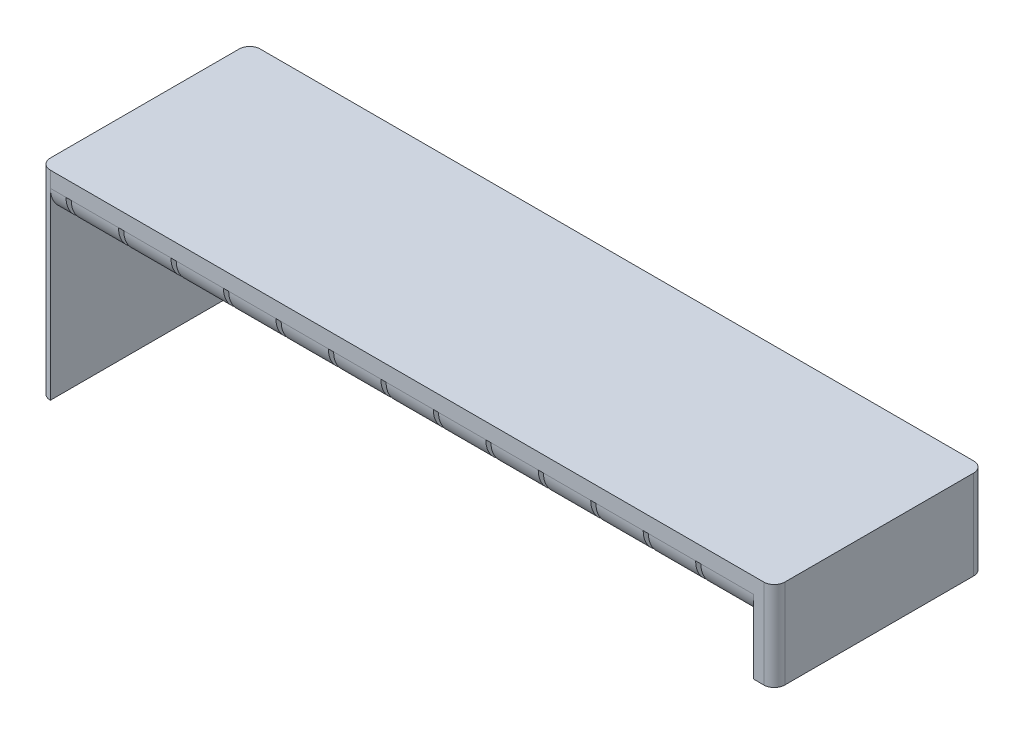
from build123d import *
from build123d.topology import SkipClean

# Parameters (mm, degrees)
SKETCH1_W           = 136
SKETCH1_H           = 40
SKETCH1_W_2         = 2
BOSS_EXTRUDE1_DEPTH = 8
SKETCH1_3_W         = 2
SKETCH1_3_H         = 40
BOSS_EXTRUDE2_DEPTH = 9
SKETCH2_W           = 10.875
SKETCH2_H           = 9
BOSS_EXTRUDE3_DEPTH = 1
BOSS_EXTRUDE4_START = 1
SKETCH2_3_W         = 10.875
SKETCH2_3_H         = 9
SKETCH2_3_W_2       = 17.05
SKETCH2_3_H_2       = 0.6
BOSS_EXTRUDE4_DEPTH = 1
SKETCH1_4_W         = 2
SKETCH1_4_H         = 40
BOSS_EXTRUDE5_DEPTH = 30
SKETCH3_R           = 12.1
CUT_EXTRUDE1_DEPTH  = 132
FILLET1_R           = 5
FILLET2_START       = -31
FILLET2_DEPTH       = 40
BOSS_EXTRUDE6_START = -2
BOSS_EXTRUDE6_DEPTH = 134
FILLET3_R           = 0.5
FILLET5_R           = 1
SKETCH4_W           = 40
SKETCH4_H           = 10
CUT_EXTRUDE2_DEPTH  = 1
LPATTERN1_COUNT     = 13
LPATTERN1_PITCH     = 10


with BuildPart() as part:
    # Sketch1 → Boss-Extrude1 (new body)
    with BuildSketch(Plane(origin=(0, 0, 0), x_dir=(1, 0, 0), z_dir=(0, 1, 0))):
        Rectangle(SKETCH1_W, SKETCH1_H)
        with Locations((69, 0)):
            Rectangle(SKETCH1_W_2, SKETCH1_H)
        with Locations((-69, 0)):
            Rectangle(SKETCH1_W_2, SKETCH1_H)
    extrude(amount=BOSS_EXTRUDE1_DEPTH)

    # Sketch1<3> → Boss-Extrude2 (add)
    with BuildSketch(Plane(origin=(0, 0, 0), x_dir=(1, 0, 0), z_dir=(0, 1, 0))):
        with Locations((69, 0)):
            Rectangle(SKETCH1_3_W, SKETCH1_3_H)
    extrude(amount=-BOSS_EXTRUDE2_DEPTH)

    # Sketch2 → Boss-Extrude3 (add)
    with BuildSketch(Plane.ZY.offset(-68)):
        with Locations((14.5625, -4.5)):
            Rectangle(SKETCH2_W, SKETCH2_H)
        with Locations((-14.5625, -4.5)):
            Rectangle(SKETCH2_W, SKETCH2_H)
    extrude(amount=BOSS_EXTRUDE3_DEPTH)

    # Sketch2<3> → Boss-Extrude4 (add)
    with BuildSketch(Plane.ZY.offset(-68).offset(BOSS_EXTRUDE4_START)):
        Polygon((9.125, -9), (9.125, 0), (8.525, 0), (8.525, -0.6), (8.525, -9), align=None)
        with Locations((14.5625, -4.5)):
            Rectangle(SKETCH2_3_W, SKETCH2_3_H)
        with Locations((0, -0.3)):
            Rectangle(SKETCH2_3_W_2, SKETCH2_3_H_2)
        Polygon((-8.525, -0.6), (-8.525, 0), (-9.125, 0), (-9.125, -9), (-8.525, -9), align=None)
        with Locations((-14.5625, -4.5)):
            Rectangle(SKETCH2_3_W, SKETCH2_3_H)
    extrude(amount=BOSS_EXTRUDE4_DEPTH)

    # Sketch1<4> → Boss-Extrude5 (add)
    with BuildSketch(Plane(origin=(0, 0, 0), x_dir=(1, 0, 0), z_dir=(0, 1, 0))):
        with Locations((-69, 0)):
            Rectangle(SKETCH1_4_W, SKETCH1_4_H)
    extrude(amount=-BOSS_EXTRUDE5_DEPTH)

    # Sketch3 → Cut-Extrude1 (cut)
    with BuildSketch(Plane.ZY.offset(-64)):
        with Locations((0, -6.5)):
            Circle(SKETCH3_R)
    extrude(amount=CUT_EXTRUDE1_DEPTH, mode=Mode.SUBTRACT)

    # Fillet1
    fillet1_edges = [part.edges().sort_by_distance(p)[0] for p in [
        (-1, 0, -20),
        (-1, 0, 20),
    ]]
    fillet(fillet1_edges, radius=FILLET1_R)

    # Fillet2: read off the stored shape, not the designer's step
    # Fillet2 outline → Fillet2 (cut)
    with BuildSketch(Plane(origin=(0, 0, 0), x_dir=(1, 0, 0), z_dir=(0, 1, 0)).offset(FILLET2_START)):
        with BuildLine():
            Line((-70, -20), (-68, -20))
            ThreePointArc((-68, -20), (-69.414213562, -19.414213562), (-70, -18))
            Line((-70, -18), (-70, -20))
        make_face()
        with BuildLine():
            ThreePointArc((70, -18), (69.414213562, -19.414213562), (68, -20))
            Line((68, -20), (70, -20))
            Line((70, -20), (70, -18))
        make_face()
        with BuildLine():
            Line((-70, 20), (-70, 18))
            ThreePointArc((-70, 18), (-69.414213562, 19.414213562), (-68, 20))
            Line((-68, 20), (-70, 20))
        make_face()
        with BuildLine():
            ThreePointArc((68, 20), (69.414213562, 19.414213562), (70, 18))
            Line((70, 18), (70, 20))
            Line((70, 20), (68, 20))
        make_face()
    extrude(amount=FILLET2_DEPTH, mode=Mode.SUBTRACT)

    # Sketch3<3> → Boss-Extrude6 (add)
    with SkipClean():  # the faces are left unmerged after this step: merging them gives an invalid solid
        with BuildSketch(Plane.ZY.offset(-64).offset(BOSS_EXTRUDE6_START)):
            with BuildLine():
                Line((-11.655363572, 0), (-11.655363572, -3.25))
                ThreePointArc((-11.655363572, -3.25), (-11.050752229, -1.571422601), (-10.205880658, 0))
                Line((-10.205880658, 0), (-11.655363572, 0))
            make_face()
            with BuildLine():
                ThreePointArc((10.205880658, 0), (11.050752229, -1.571422601), (11.655363572, -3.25))
                Line((11.655363572, -3.25), (11.655363572, 0))
                Line((11.655363572, 0), (10.205880658, 0))
            make_face()
        extrude(amount=BOSS_EXTRUDE6_DEPTH)

    # Fillet3
    fillet3_edges = [part.edges().sort_by_distance(p)[0] for p in [
        (-1, -3.25, -11.655363572),
        (-1, -3.25, 11.655363572),
    ]]
    fillet(fillet3_edges, radius=FILLET3_R)

    # Fillet5
    # the kernel refuses this fillet: 1 mm, written as the material it takes off along each edge
    with BuildSketch(Plane(origin=(64, 0, -12.705880658), x_dir=(1, 0, 0), z_dir=(0, 0, 1))) as fillet5_piece_1_section:
        with BuildLine():
            CenterArc((FILLET5_R, FILLET5_R), FILLET5_R, 180, 90)
            Line((0, FILLET5_R), (0, 0))
            Line((0, 0), (FILLET5_R, 0))
        make_face()
    fillet5_piece_1 = extrude(amount=25.411761315, mode=Mode.PRIVATE)
    fillet5_piece_1 = fillet5_piece_1 & Plane(origin=(64, -6.5, 0), x_dir=(0, 0.5371900826446553, 0.8434612113833264), z_dir=(1, 0, 0)) * Cylinder(12.1, 55, mode=Mode.PRIVATE)
    add(fillet5_piece_1, mode=Mode.SUBTRACT)

    # Sketch4 → Cut-Extrude2 (cut)
    with BuildSketch(Plane.ZY.offset(-56)):
        Rectangle(SKETCH4_W, SKETCH4_H)
    cut_extrude2 = extrude(amount=CUT_EXTRUDE2_DEPTH, mode=Mode.SUBTRACT)

    # LPattern1: Cut-Extrude2 ×13
    with Locations(*[(-i * LPATTERN1_PITCH, 0, 0) for i in range(1, LPATTERN1_COUNT)]):
        add(cut_extrude2, mode=Mode.SUBTRACT)


solid = part.part
